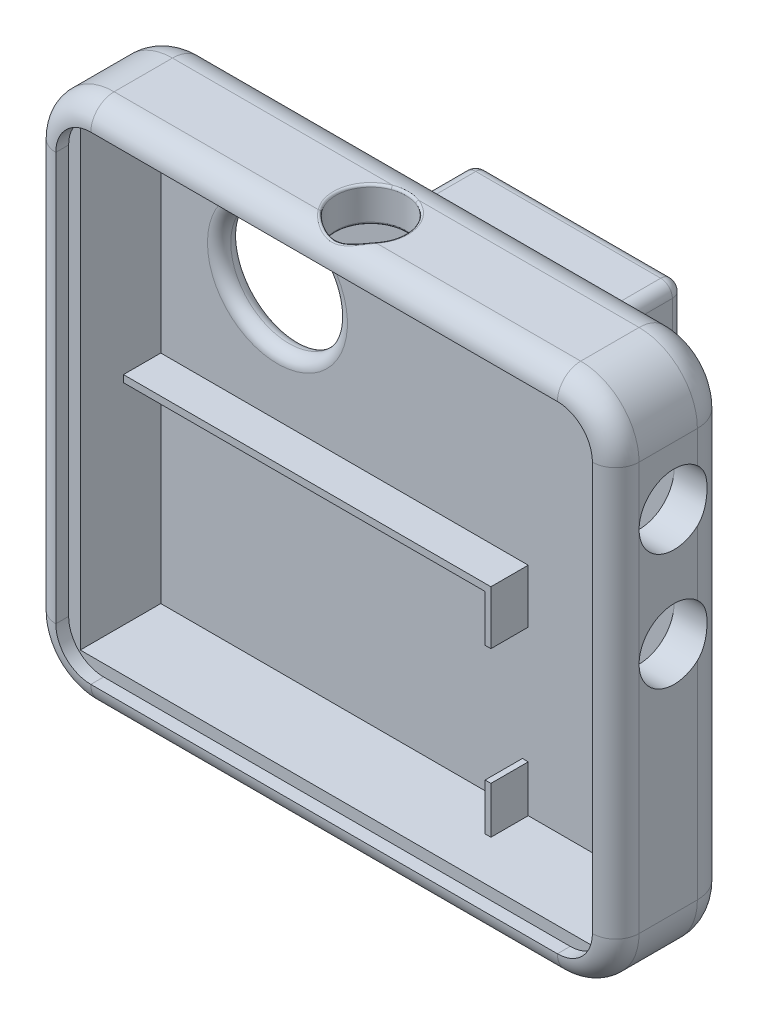
from build123d import *

# Parameters (mm, degrees)
ESBO_O1_W                = 50
ESBO_O1_H                = 45
RESSALTO_EXTRUS_O1_DEPTH = 10
FILETE1_R                = 5
FILETE2_R                = 3
FILETE3_R                = 2
ESBO_O2_W                = 44
ESBO_O2_H                = 39
CORTE_EXTRUS_O1_DEPTH    = 8
RESSALTO_EXTRUS_O3_DEPTH = 3.2
ESBO_O5_W                = 5
ESBO_O5_H                = 10
CORTE_EXTRUS_O2_DEPTH    = 3.2
ESBO_O6_R                = 5
CORTE_EXTRUS_O3_DEPTH    = 3.2
FILETE4_R                = 1
ESBO_O7_R                = 3
CORTE_EXTRUS_O4_DEPTH    = 3.2
ESBO_O8_R                = 3
CORTE_EXTRUS_O5_DEPTH    = 3.2
FILETE7_R                = 0.2
CORTE_EXTRUS_O11_DEPTH   = 1.1
ESBO_O13_W               = 17.854236102
ESBO_O13_H               = 5
RESSALTO_EXTRUS_O5_DEPTH = 8
ESBO_O14_W               = 17.854236102
ESBO_O14_H               = 5
RESSALTO_EXTRUS_O6_DEPTH = 20
FILETE11_R               = 1


with BuildPart() as part:
    # Esboço1 → Ressalto-extrusão1 (new body)
    with BuildSketch(Plane.XY):
        with Locations((5, 0)):
            Rectangle(ESBO_O1_W, ESBO_O1_H)
    extrude(amount=RESSALTO_EXTRUS_O1_DEPTH)

    # Filete1
    filete1_edges = [part.edges().sort_by_distance(p)[0] for p in [
        (-20, 22.5, 5),
        (30, 22.5, 5),
        (30, -22.5, 5),
        (-20, -22.5, 5),
    ]]
    fillet(filete1_edges, radius=FILETE1_R)

    # Filete2
    filete2_edges = [part.edges().sort_by_distance(p)[0] for p in [
        (-20, 0, 0),
        (5, 22.5, 0),
        (30, 0, 0),
        (5, -22.5, 0),
        (28.535533906, 21.035533906, 0),
        (28.535533906, -21.035533906, 0),
        (-18.535533906, -21.035533906, 0),
        (-18.535533906, 21.035533906, 0),
    ]]
    fillet(filete2_edges, radius=FILETE2_R)

    # Filete3
    filete3_edges = [part.edges().sort_by_distance(p)[0] for p in [
        (-20, 0, 10),
        (5, 22.5, 10),
        (5, -22.5, 10),
        (30, 0, 10),
        (28.535533906, 21.035533906, 10),
        (28.535533906, -21.035533906, 10),
        (-18.535533906, -21.035533906, 10),
        (-18.535533906, 21.035533906, 10),
    ]]
    fillet(filete3_edges, radius=FILETE3_R)

    # Esboço2 → Corte-extrusão1 (cut)
    with BuildSketch(Plane.XY.offset(10)):
        with Locations((5, 0)):
            Rectangle(ESBO_O2_W, ESBO_O2_H)
    extrude(amount=-CORTE_EXTRUS_O1_DEPTH, mode=Mode.SUBTRACT)

    # Esboço3 → Ressalto-extrusão3 (add)
    with BuildSketch(Plane.XY.offset(2)):
        Polygon((14.499434738, -0.900273227), (-17, -0.900273227), (-17, -1.5), (14, -1.5), (14, -19.5), (14.499434738, -19.5), align=None)
    extrude(amount=RESSALTO_EXTRUS_O3_DEPTH)

    # Esboço5 → Corte-extrusão2 (cut)
    with BuildSketch(Plane.ZY.offset(-14)):
        with Locations((4.5, -10.5)):
            Rectangle(ESBO_O5_W, ESBO_O5_H)
    extrude(amount=-CORTE_EXTRUS_O2_DEPTH, mode=Mode.SUBTRACT)

    # Esboço6 → Corte-extrusão3 (cut)
    with BuildSketch(Plane.XY.offset(2)):
        with Locations((-7, 9.299863387)):
            Circle(ESBO_O6_R)
    extrude(amount=-CORTE_EXTRUS_O3_DEPTH, mode=Mode.SUBTRACT)

    # Filete4
    filete4_edges = [part.edges().sort_by_distance(p)[0] for p in [
        (-12, 9.299863387, 0),
        (-12, 9.299863387, 2),
    ]]
    fillet(filete4_edges, radius=FILETE4_R - 0.0001)  # a hair under: the kernel refuses the full size

    # Esboço7 → Corte-extrusão4 (cut)
    with BuildSketch(Plane(origin=(30, 0, 0), x_dir=(0, 0, -1), z_dir=(1, 0, 0))):
        with Locations(Location((-5, 2.5, 0), (0, 0, 48.189685104))):
            Circle(ESBO_O7_R)
        with Locations(Location((-5, 12.5, 0), (0, 0, 48.189685104))):
            Circle(ESBO_O7_R)
    extrude(amount=-CORTE_EXTRUS_O4_DEPTH, mode=Mode.SUBTRACT)

    # Esboço8 → Corte-extrusão5 (cut)
    with BuildSketch(Plane.XZ.offset(-19.5)):
        with Locations(Location((5, 6, 0), (0, 0, 270))):
            Circle(ESBO_O8_R)
    extrude(amount=-CORTE_EXTRUS_O5_DEPTH, mode=Mode.SUBTRACT)

    # Filete7
    filete7_edges = [part.edges().sort_by_distance(p)[0] for p in [
        (2.261387212, 22.5, 4.775255129),
        (7.738612788, 22.5, 4.775255129),
        (5, 22.232050808, 9),
        (5, 19.5, 9),
    ]]
    fillet(filete7_edges, radius=FILETE7_R)

    # Esboço11 → Corte-extrusão11 (cut)
    with BuildSketch(Plane.XY.offset(10)):
        with BuildLine():
            Line((-18, 17.5), (-18, -17.5))
            ThreePointArc((-18, -17.5), (-17.121320344, -19.621320344), (-15, -20.5))
            Line((-15, -20.5), (25, -20.5))
            ThreePointArc((25, -20.5), (27.121320344, -19.621320344), (28, -17.5))
            Line((28, -17.5), (28, 17.5))
            ThreePointArc((28, 17.5), (27.121320344, 19.621320344), (25, 20.5))
            Line((25, 20.5), (-15, 20.5))
            ThreePointArc((-15, 20.5), (-17.121320344, 19.621320344), (-18, 17.5))
        make_face()
    extrude(amount=-CORTE_EXTRUS_O11_DEPTH, mode=Mode.SUBTRACT)

    # Esboço13 → Ressalto-extrusão5 (add)
    with BuildSketch(Plane(origin=(0, 0, 0), x_dir=(-1, 0, 0), z_dir=(0, 0, -1))):
        with Locations((-8.927118051, 14.581619967)):
            Rectangle(ESBO_O13_W, ESBO_O13_H)
    extrude(amount=RESSALTO_EXTRUS_O5_DEPTH)

    # Esboço14 → Ressalto-extrusão6 (add)
    with BuildSketch(Plane.XZ.offset(-12.081619967)):
        with Locations((8.927118051, -5.5)):
            Rectangle(ESBO_O14_W, ESBO_O14_H)
    extrude(amount=RESSALTO_EXTRUS_O6_DEPTH)

    # Filete11
    filete11_edges = [part.edges().sort_by_distance(p)[0] for p in [
        (17.854236102, 17.081619967, -4),
        (0, 17.081619967, -4),
        (17.854236102, 4.581619967, -8),
        (0, 4.581619967, -8),
        (8.927118051, 17.081619967, -8),
        (0, 12.081619967, -1.5),
        (17.854236102, 12.081619967, -1.5),
        (0, 2.081619967, -3),
        (17.854236102, 2.081619967, -3),
        (0, -7.918380033, -5.5),
        (8.927118051, -7.918380033, -8),
        (17.854236102, -7.918380033, -5.5),
        (8.927118051, -7.918380033, -3),
    ]]
    fillet(filete11_edges, radius=FILETE11_R)


solid = part.part
